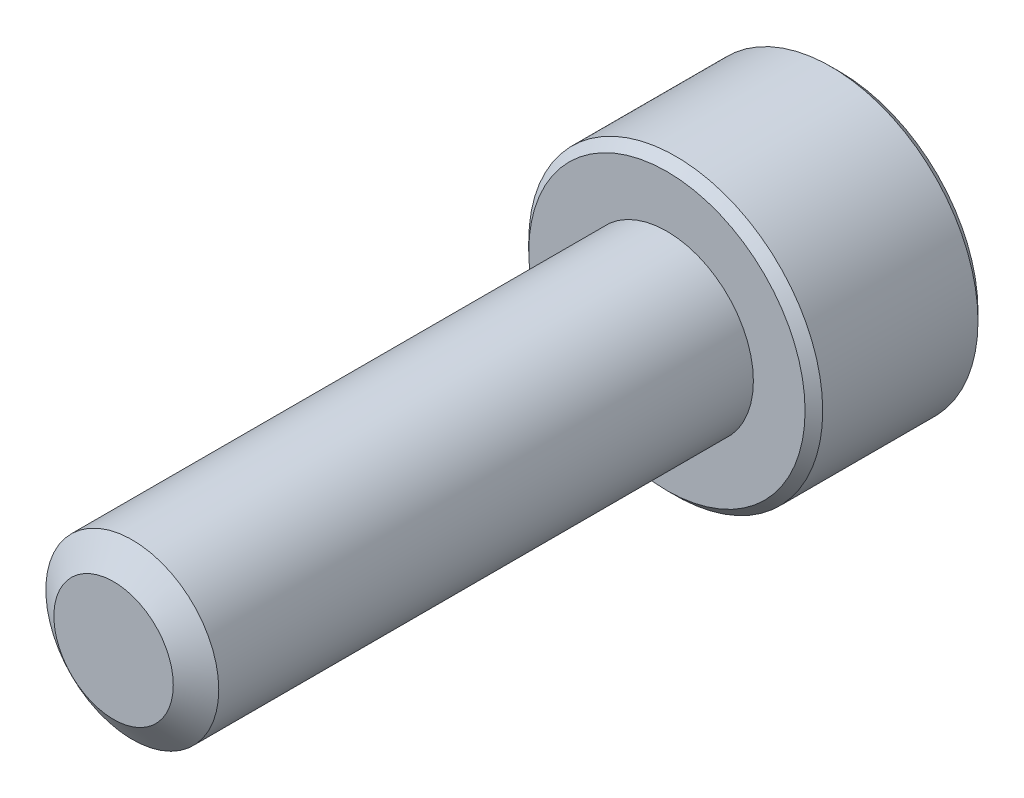
from build123d import *

# Parameters (mm, degrees)
SKETCH1_R          = 2.5
EXTRUDE1_DEPTH     = 16
SKETCH6_R          = 4.25
EXTRUDE2_DEPTH     = 5
CUT_EXTRUDE1_DEPTH = 3
CHAMFER1_SIZE      = 0.255


with BuildPart() as part:
    # Sketch1 → Extrude1 (new body)
    with BuildSketch(Plane.XY):
        Circle(SKETCH1_R)
    extrude(amount=-EXTRUDE1_DEPTH)

    # Sketch4 → Cut-Revolve1 (revolve, cut)
    with BuildSketch(Plane(origin=(0, 0, 0), x_dir=(0, 0, -1), z_dir=(1, 0, 0))):
        Polygon((0.541691224, 2.5), (0, 1.726384758), (0, 2.5), align=None)
    revolve(axis=Axis((0, 0, 0), (0, 0, -1)), mode=Mode.SUBTRACT)

    # Sketch6 → Extrude2 (add)
    with BuildSketch(Plane(origin=(0, 0, -16), x_dir=(-1, 0, 0), z_dir=(0, 0, -1))):
        Circle(SKETCH6_R)
    extrude(amount=EXTRUDE2_DEPTH)

    # Sketch7 → Cut-Extrude1 (cut)
    with BuildSketch(Plane(origin=(0, 0, -21), x_dir=(-1, 0, 0), z_dir=(0, 0, -1))):
        Polygon((0, 2.309401077), (-2, 1.154700538), (-2, -1.154700538), (0, -2.309401077), (2, -1.154700538), (2, 1.154700538), align=None)
    extrude(amount=-CUT_EXTRUDE1_DEPTH, mode=Mode.SUBTRACT)

    # Cut-Extrude2 cone 1 section (through the dimple's axis) → Cut-Extrude2 (revolve, cut)
    with BuildSketch(Plane(origin=(0, 0, -21), x_dir=(0, 1, 0), z_dir=(1, 0, 0))):
        Polygon((0, 0), (2.309401077, 0), (0, 2.309401077), align=None)
    revolve(axis=Axis((0, 0, -21), (0, 0, 1)), mode=Mode.SUBTRACT)

    # Chamfer1
    chamfer1_edges = [part.edges().sort_by_distance(p)[0] for p in [
        (4.25, 0, -21),
        (4.25, 0, -16),
    ]]
    chamfer(chamfer1_edges, length=CHAMFER1_SIZE)

    # Sketch10 → Revolve1 (revolve)
    with BuildSketch(Plane(origin=(0, 0, 0), x_dir=(0, 0, -1), z_dir=(1, 0, 0))):
        Polygon((16, 2.5), (16, 0), (14.764466094, 0), (15.8, 2.5), align=None)
    revolve(axis=Axis((0, 0, -16), (0, 0, 1)))


solid = part.part
